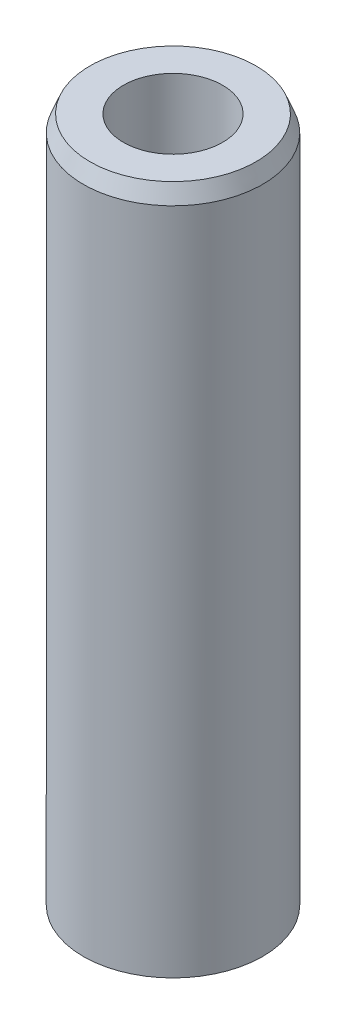
from build123d import *
from OCP.BRepFilletAPI import BRepFilletAPI_MakeChamfer

# Parameters (mm, degrees)
SKETCH1_R           = 10
BOSS_EXTRUDE1_DEPTH = 77.155231875
SKETCH2_R           = 5.531033906
CUT_EXTRUDE1_DEPTH  = 79.440613242
CHAMFER1_SIZE       = 1.825110349
CHAMFER1_SIZE2      = 0.732391666


with BuildPart() as part:
    # Sketch1 → Boss-Extrude1 (new body)
    with BuildSketch(Plane(origin=(0, 0, 0), x_dir=(1, 0, 0), z_dir=(0, 1, 0))):
        Circle(SKETCH1_R)
    extrude(amount=BOSS_EXTRUDE1_DEPTH)

    # Sketch2 → Cut-Extrude1 (cut, through all)
    with BuildSketch(Plane(origin=(0, 0, 0), x_dir=(1, 0, 0), z_dir=(0, 1, 0))):
        Circle(SKETCH2_R)
    extrude(amount=CUT_EXTRUDE1_DEPTH, mode=Mode.SUBTRACT)

    # Chamfer1: one chamfer whose edges measure the first distance from different faces: ONE call of the kernel's chamfer builder (chamfer() names one face for all edges)
    chamfer1_edges_1 = [part.edges().sort_by_distance(p)[0] for p in [
        (-10, 77.155231875, 0),
    ]]
    chamfer1_side_1 = [part.faces().sort_by_distance(p)[0] for p in [
        (-10, 38.577615938, 0),
    ]]
    chamfer1_edges_2 = [part.edges().sort_by_distance(p)[0] for p in [
        (-10, 0, 0),
    ]]
    chamfer1_side_2 = [part.faces().sort_by_distance(p)[0] for p in [
        (-9.717157288, 0, 0),
    ]]
    chamfer1 = BRepFilletAPI_MakeChamfer(part.part.solid().wrapped)
    for e in chamfer1_edges_1:
        chamfer1.Add(CHAMFER1_SIZE, CHAMFER1_SIZE2, e.wrapped, chamfer1_side_1[0].wrapped)  # the first distance lies on this face
    for e in chamfer1_edges_2:
        chamfer1.Add(CHAMFER1_SIZE, CHAMFER1_SIZE2, e.wrapped, chamfer1_side_2[0].wrapped)  # the first distance lies on this face
    add(Compound.cast(chamfer1.Shape()), mode=Mode.REPLACE)


solid = part.part
